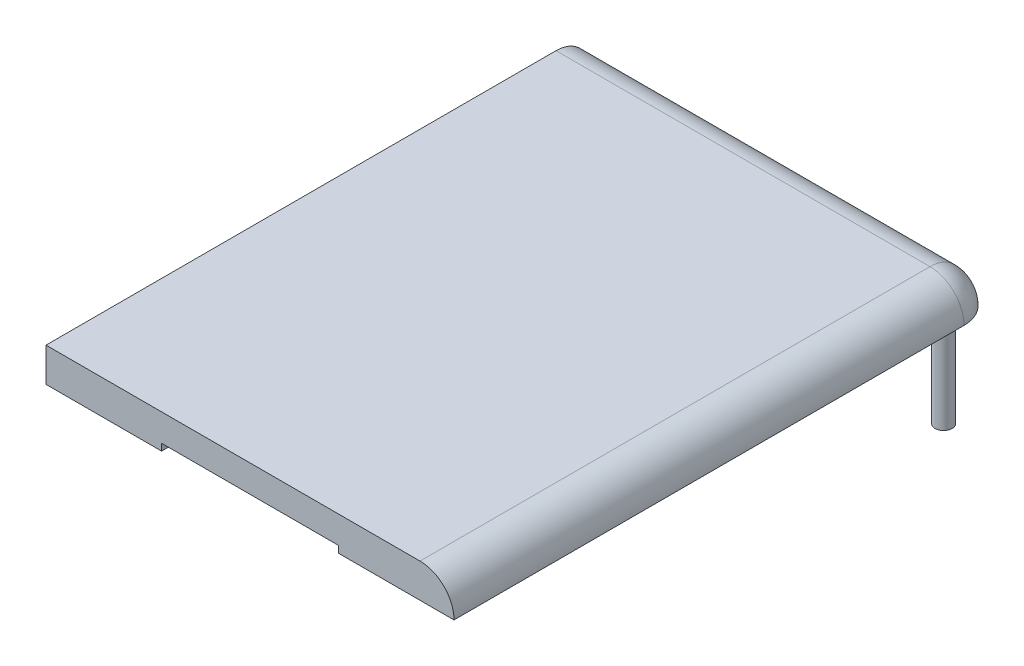
from build123d import *

# Parameters (mm, degrees)
ESQUISSE1_W             = 120
ESQUISSE1_H             = 160
BOSS_EXTRU_1_DEPTH      = 10
CONG_1_R                = 10
CONG_2_R                = 10
ESQUISSE2_R             = 2.5
BOSS_EXTRU_2_DEPTH      = 30
ESQUISSE3_W             = 11
ESQUISSE3_H             = 52
ESQUISSE3_W_2           = 52
ESQUISSE3_H_2           = 11
ENL_V_MAT_EXTRU_1_DEPTH = 2


with BuildPart() as part:
    # Esquisse1 → Boss.-Extru.1 (new body)
    with BuildSketch(Plane(origin=(0, 0, 0), x_dir=(1, 0, 0), z_dir=(0, 1, 0))):
        with Locations((60, 80)):
            Rectangle(ESQUISSE1_W, ESQUISSE1_H)
    extrude(amount=BOSS_EXTRU_1_DEPTH)

    # Congé1
    cong_1_edges = [part.edges().sort_by_distance(p)[0] for p in [
        (120, 10, -80),
    ]]
    fillet(cong_1_edges, radius=CONG_1_R - 0.0001)  # a hair under: the kernel refuses the full size

    # Congé2
    cong_2_edges = [part.edges().sort_by_distance(p)[0] for p in [
        (117.071097101, 7.071097101, -160),
        (55.00005, 10, -160),
    ]]
    fillet(cong_2_edges, radius=CONG_2_R - 0.0001)  # a hair under: the kernel refuses the full size

    # Esquisse2 → Boss.-Extru.2 (add)
    with BuildSketch(Plane.XZ):
        with Locations(Location((112, -152, 0), (0, 0, 270))):
            Circle(ESQUISSE2_R)
    extrude(amount=BOSS_EXTRU_2_DEPTH)

    # Esquisse3 → Enlèv. mat.-Extru.1 (cut)
    with BuildSketch(Plane.XZ):
        with Locations((5.5, -80)):
            Rectangle(ESQUISSE3_W, ESQUISSE3_H)
        with Locations((60, -5.5)):
            Rectangle(ESQUISSE3_W_2, ESQUISSE3_H_2)
    extrude(amount=-ENL_V_MAT_EXTRU_1_DEPTH, mode=Mode.SUBTRACT)


solid = part.part
